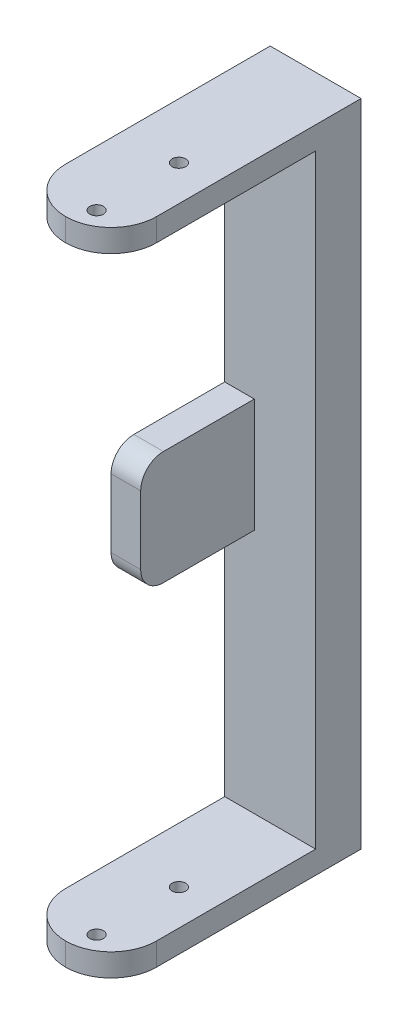
from build123d import *

# Parameters (mm, degrees)
SKETCH1_W           = 20
SKETCH1_H           = 143
BOSS_EXTRUDE1_DEPTH = 10
SKETCH2_W           = 20
SKETCH2_H           = 5
BOSS_EXTRUDE2_DEPTH = 45
FILLET1_R           = 10
SKETCH6_R           = 1.5
CUT_EXTRUDE1_DEPTH  = 155.512135446
SKETCH2_3_W         = 6.51
SKETCH2_3_H         = 12.5
BOSS_EXTRUDE3_DEPTH = 25
FILLET2_R           = 5


with BuildPart() as part:
    # Sketch1 → Boss-Extrude1 (new body)
    with BuildSketch(Plane.XY):
        with Locations((-10, 0)):
            Rectangle(SKETCH1_W, SKETCH1_H)
    extrude(amount=BOSS_EXTRUDE1_DEPTH)

    # Sketch2 → Boss-Extrude2 (add)
    with BuildSketch(Plane.XY.offset(10)):
        with Locations((-10, 69)):
            Rectangle(SKETCH2_W, SKETCH2_H)
        with Locations((-10, -69)):
            Rectangle(SKETCH2_W, SKETCH2_H)
    extrude(amount=BOSS_EXTRUDE2_DEPTH)

    # Fillet1
    fillet1_edges = [part.edges().sort_by_distance(p)[0] for p in [
        (-20, -69, 55),
        (0, -69, 55),
        (-20, 69, 55),
        (0, 69, 55),
    ]]
    fillet(fillet1_edges, radius=FILLET1_R - 0.0001)  # a hair under: the kernel refuses the full size

    # Sketch6 → Cut-Extrude1 (cut, through all)
    with BuildSketch(Plane(origin=(0, 71.5, 0), x_dir=(1, 0, 0), z_dir=(0, 1, 0))):
        with Locations(Location((-7.8, -32.283583697, 0), (0, 0, 270))):
            Circle(SKETCH6_R)
        with Locations(Location((-7.8, -50.383583697, 0), (0, 0, 270))):
            Circle(SKETCH6_R)
    extrude(amount=-CUT_EXTRUDE1_DEPTH, mode=Mode.SUBTRACT)

    # Sketch2<3> → Boss-Extrude3 (add)
    with BuildSketch(Plane.XY.offset(10)):
        with Locations((-16.745, -6.25)):
            Rectangle(SKETCH2_3_W, SKETCH2_3_H)
        with Locations((-16.745, 6.25)):
            Rectangle(SKETCH2_3_W, SKETCH2_3_H)
    extrude(amount=BOSS_EXTRUDE3_DEPTH)

    # Fillet2
    fillet2_edges = [part.edges().sort_by_distance(p)[0] for p in [
        (-16.745, -12.5, 35),
        (-16.745, 12.5, 35),
    ]]
    fillet(fillet2_edges, radius=FILLET2_R)


solid = part.part
